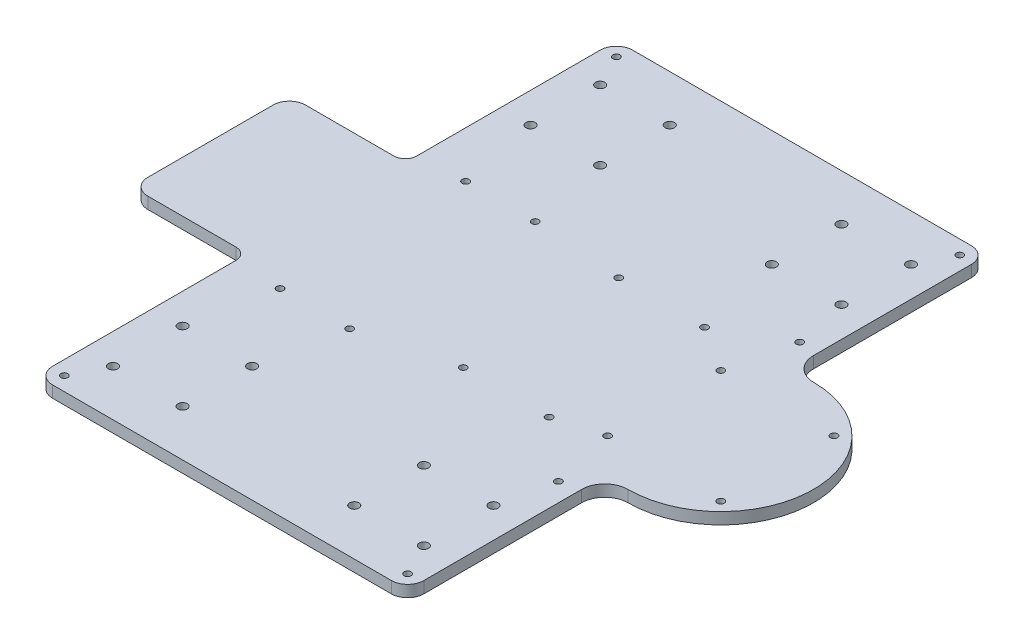
from build123d import *

# Parameters (mm, degrees)
SKETCH_1_R      = 1.5
SKETCH_1_R_2    = 2
EXTRUDE_1_DEPTH = 5
FILLET_1_R      = 7
FILLET_4_R      = 5
FILLET_6_R      = 10


with BuildPart() as part:
    # 草图1 → 凸台-拉伸1 (new body)
    with BuildSketch(Plane(origin=(0, 0, 0), x_dir=(1, 0, 0), z_dir=(0, 1, 0))):
        with BuildLine():
            Line((0, 0), (160, 0))
            Line((160, 0), (160, -85))
            Line((160, -85), (170, -85))
            ThreePointArc((170, -85), (210, -125), (170, -165))
            Line((170, -165), (160, -165))
            Line((160, -165), (160, -250))
            Line((160, -250), (0, -250))
            Line((0, -250), (0, -159))
            Line((0, -159), (-50, -159))
            Line((-50, -159), (-50, -91))
            Line((-50, -91), (0, -91))
            Line((0, -91), (0, 0))
        make_face()
        with Locations(Location((154, -6, 0), (0, 0, 270))):
            Circle(SKETCH_1_R, mode=Mode.SUBTRACT)
        with Locations(Location((6, -6, 0), (0, 0, 90))):
            Circle(SKETCH_1_R, mode=Mode.SUBTRACT)
        with Locations(Location((152, -73, 0), (0, 0, 270))):
            Circle(SKETCH_1_R, mode=Mode.SUBTRACT)
        with Locations(Location((152, -177, 0), (0, 0, 90))):
            Circle(SKETCH_1_R, mode=Mode.SUBTRACT)
        with Locations(Location((154, -244, 0), (0, 0, 90))):
            Circle(SKETCH_1_R, mode=Mode.SUBTRACT)
        with Locations(Location((6, -244, 0), (0, 0, 270))):
            Circle(SKETCH_1_R, mode=Mode.SUBTRACT)
        with Locations(Location((50, -85, 0), (0, 0, 270))):
            Circle(SKETCH_1_R, mode=Mode.SUBTRACT)
        with Locations(Location((50, -165, 0), (0, 0, 90))):
            Circle(SKETCH_1_R, mode=Mode.SUBTRACT)
        with Locations(Location((13, -20, 0), (0, 0, 270))):
            Circle(SKETCH_1_R_2, mode=Mode.SUBTRACT)
        with Locations(Location((13, -200, 0), (0, 0, 270))):
            Circle(SKETCH_1_R_2, mode=Mode.SUBTRACT)
        with Locations(Location((20, -85, 0), (0, 0, 270))):
            Circle(SKETCH_1_R, mode=Mode.SUBTRACT)
        with Locations(Location((20, -165, 0), (0, 0, 90))):
            Circle(SKETCH_1_R, mode=Mode.SUBTRACT)
        with Locations(Location((89, -88, 0), (0, 0, 270))):
            Circle(SKETCH_1_R, mode=Mode.SUBTRACT)
        with Locations(Location((126, -88, 0), (0, 0, 270))):
            Circle(SKETCH_1_R, mode=Mode.SUBTRACT)
        with Locations(Location((126, -155, 0), (0, 0, 270))):
            Circle(SKETCH_1_R, mode=Mode.SUBTRACT)
        with Locations(Location((89, -155, 0), (0, 0, 270))):
            Circle(SKETCH_1_R, mode=Mode.SUBTRACT)
        with Locations(Location((43, -200, 0), (0, 0, 270))):
            Circle(SKETCH_1_R_2, mode=Mode.SUBTRACT)
        with Locations(Location((13, -230, 0), (0, 0, 270))):
            Circle(SKETCH_1_R_2, mode=Mode.SUBTRACT)
        with Locations(Location((43, -230, 0), (0, 0, 270))):
            Circle(SKETCH_1_R_2, mode=Mode.SUBTRACT)
        with Locations(Location((117, -230, 0), (0, 0, 90))):
            Circle(SKETCH_1_R_2, mode=Mode.SUBTRACT)
        with Locations(Location((147, -230, 0), (0, 0, 90))):
            Circle(SKETCH_1_R_2, mode=Mode.SUBTRACT)
        with Locations(Location((117, -200, 0), (0, 0, 90))):
            Circle(SKETCH_1_R_2, mode=Mode.SUBTRACT)
        with Locations(Location((147, -200, 0), (0, 0, 90))):
            Circle(SKETCH_1_R_2, mode=Mode.SUBTRACT)
        with Locations(Location((43, -20, 0), (0, 0, 270))):
            Circle(SKETCH_1_R_2, mode=Mode.SUBTRACT)
        with Locations(Location((13, -50, 0), (0, 0, 270))):
            Circle(SKETCH_1_R_2, mode=Mode.SUBTRACT)
        with Locations(Location((43, -50, 0), (0, 0, 270))):
            Circle(SKETCH_1_R_2, mode=Mode.SUBTRACT)
        with Locations(Location((117, -20, 0), (0, 0, 90))):
            Circle(SKETCH_1_R_2, mode=Mode.SUBTRACT)
        with Locations(Location((117, -50, 0), (0, 0, 90))):
            Circle(SKETCH_1_R_2, mode=Mode.SUBTRACT)
        with Locations(Location((147, -50, 0), (0, 0, 90))):
            Circle(SKETCH_1_R_2, mode=Mode.SUBTRACT)
        with Locations(Location((147, -20, 0), (0, 0, 90))):
            Circle(SKETCH_1_R_2, mode=Mode.SUBTRACT)
        with Locations(Location((145.605, -100.605, 0), (0, 0, 270))):
            Circle(SKETCH_1_R, mode=Mode.SUBTRACT)
        with Locations(Location((194.395, -100.605, 0), (0, 0, 270))):
            Circle(SKETCH_1_R, mode=Mode.SUBTRACT)
        with Locations(Location((194.395, -149.395, 0), (0, 0, 270))):
            Circle(SKETCH_1_R, mode=Mode.SUBTRACT)
        with Locations(Location((145.605, -149.395, 0), (0, 0, 270))):
            Circle(SKETCH_1_R, mode=Mode.SUBTRACT)
    extrude(amount=EXTRUDE_1_DEPTH)

    # 圆角1
    fillet_1_edges = [part.edges().sort_by_distance(p)[0] for p in [
        (0, 2.5, 0),
        (160, 2.5, 0),
        (160, 2.5, 250),
        (0, 2.5, 250),
        (-50, 2.5, 159),
        (-50, 2.5, 91),
    ]]
    fillet(fillet_1_edges, radius=FILLET_1_R)

    # 圆角4
    fillet_4_edges = [part.edges().sort_by_distance(p)[0] for p in [
        (0, 2.5, 159),
        (0, 2.5, 91),
    ]]
    fillet(fillet_4_edges, radius=FILLET_4_R)

    # 圆角6
    fillet_6_edges = [part.edges().sort_by_distance(p)[0] for p in [
        (160, 2.5, 85),
        (160, 2.5, 165),
    ]]
    fillet(fillet_6_edges, radius=FILLET_6_R - 0.0001)  # a hair under: the kernel refuses the full size


solid = part.part
